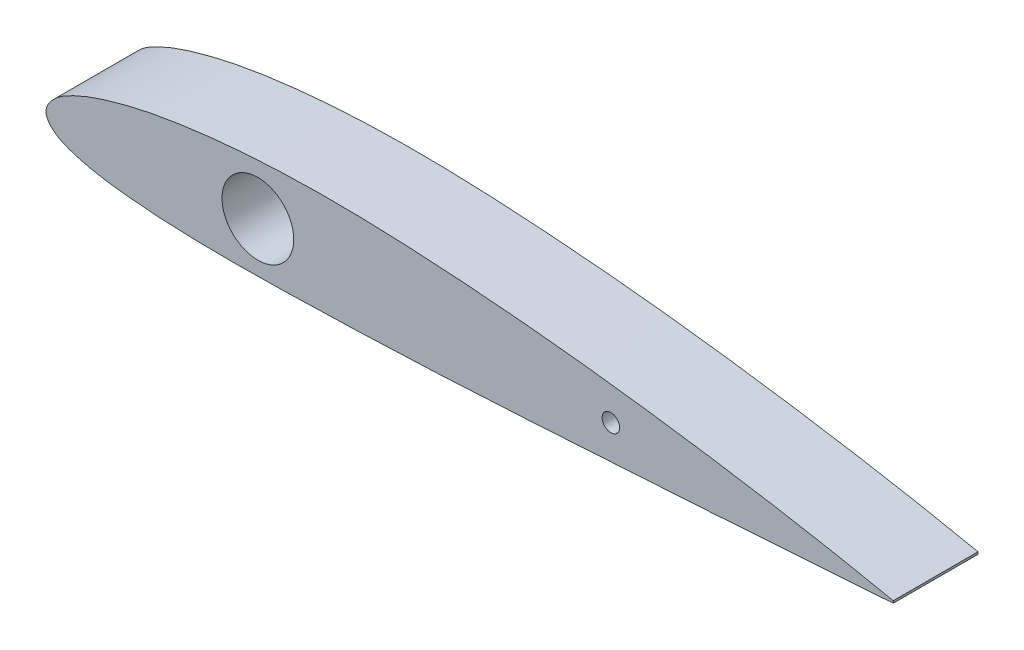
from build123d import *

# Parameters (mm, degrees)
SKETCH1_R           = 12.7
SKETCH1_R_2         = 3.1
BOSS_EXTRUDE1_DEPTH = 30


with BuildPart() as part:
    # Sketch1 → Boss-Extrude1 (new body)
    with BuildSketch(Plane.XY):
        with BuildLine():
            Line((269.75606318, 0.39), (269.75606318, -0.39))
            add(Edge.make_bspline(
                [(269.75606318, 0.39), (264.758836378, 1.414000082), (254.777507596, 3.45931079), (234.797708888, 7.205579334), (209.809502227, 11.35644797), (179.803810027, 15.652495779), (149.803067524, 19.235240906), (119.789318532, 21.858580513), (89.782404697, 23.635097209), (64.746727737, 23.935808407), (44.737918653, 23.107465721), (29.719041415, 21.893704318), (14.681203014, 19.97163417), (2.165982385, 17.604753461), (-7.811397109, 14.926973956), (-15.375659845, 12.492476274), (-21.78446685, 9.655920822), (-27.312645833, 6.216911108), (-32.133405509, 0.269631354), (-27.125920641, -4.957920198), (-21.701145045, -7.342160266), (-15.320533432, -9.153243486), (-7.781174347, -10.451795047), (2.236136575, -11.559964158), (14.740172541, -12.412907572), (29.754296801, -12.754877712), (44.757705477, -12.707223024), (64.759558695, -12.26571363), (89.764209215, -11.471242967), (119.766079926, -10.088623246), (149.759251014, -8.291561108), (179.757509222, -6.423658887), (209.760896614, -4.532938454), (234.755492949, -2.791593222), (254.757335305, -1.448461772), (264.756258336, -0.742836743), (269.75606318, -0.39)],
                knots=[0, 0, 0, 0, 0.02501249, 0.049959286, 0.099672925, 0.14920632, 0.198581097, 0.24780517, 0.296916575, 0.345952722, 0.370491626, 0.395091204, 0.419814796, 0.444798575, 0.457489819, 0.470406405, 0.483879409, 0.49126412, 0.503458853, 0.513609129, 0.520450991, 0.533235388, 0.545691039, 0.558031884, 0.582609167, 0.607134742, 0.63165208, 0.656174272, 0.705233949, 0.754320379, 0.803437364, 0.852566096, 0.901700994, 0.950848809, 0.975422717, 1, 1, 1, 1], degree=3))
        make_face()
        with Locations((44.75606318, 5)):
            Circle(SKETCH1_R, mode=Mode.SUBTRACT)
        with Locations((169.75606318, 5)):
            Circle(SKETCH1_R_2, mode=Mode.SUBTRACT)
    extrude(amount=BOSS_EXTRUDE1_DEPTH)


solid = part.part
